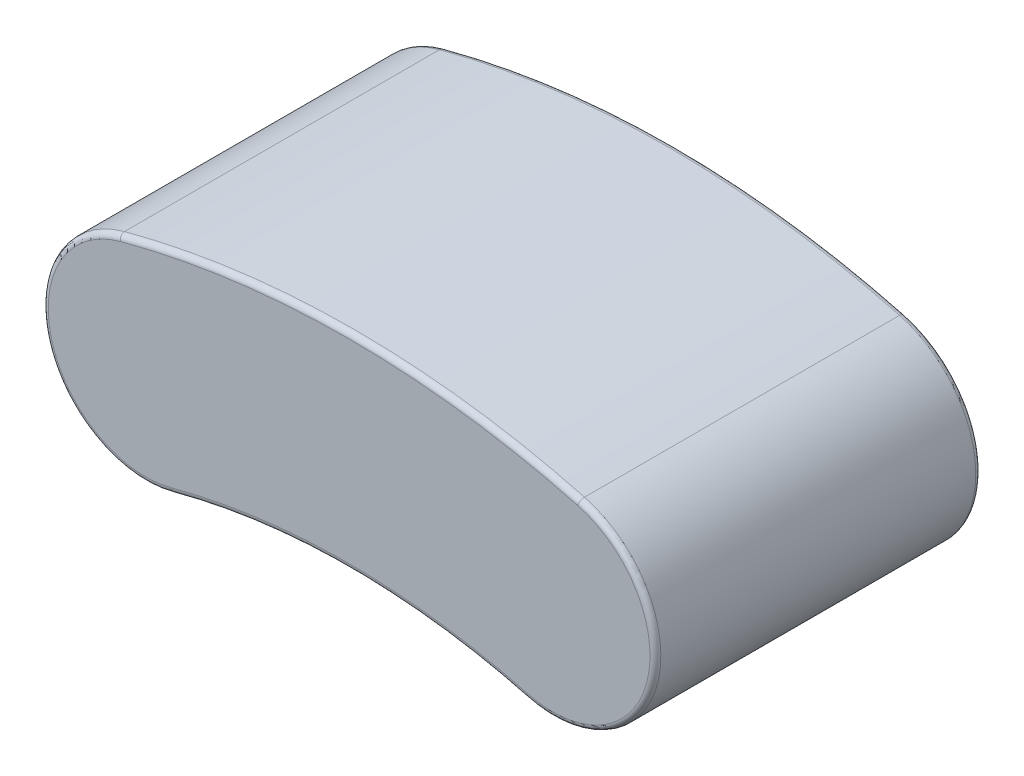
from build123d import *

# Parameters (mm, degrees)
BOSS_EXTRU_1_DEPTH = 120
CONG_1_R           = 2
CONG_2_R           = 2
COQUE1_DEPTH       = 117


# Read off the part's stored shape, not the designer's step: Coque1
with BuildPart() as part:
    # Esquisse2 → Boss.-Extru.1 (new body)
    with BuildSketch(Plane.XY):
        with BuildLine():
            ThreePointArc((84.733796148, 26.7419608), (0, 37.829829119), (-84.733796148, 26.7419608))
            ThreePointArc((-84.733796148, 26.7419608), (-111.556110074, -19.547945422), (-65.266203852, -46.370259347))
            ThreePointArc((-65.266203852, -46.370259347), (0, -37.829829119), (65.266203852, -46.370259347))
            ThreePointArc((65.266203852, -46.370259347), (111.556110074, -19.547945422), (84.733796148, 26.7419608))
        make_face()
    extrude(amount=BOSS_EXTRU_1_DEPTH)

    # Congé1
    cong_1_edges = [part.edges().sort_by_distance(p)[0] for p in [
        (-111.556110074, -19.547945422, 120),
        (0, -37.829829119, 120),
        (111.556110074, -19.547945422, 120),
        (0, 37.829829119, 120),
    ]]
    fillet(cong_1_edges, radius=CONG_1_R)

    # Congé2
    cong_2_edges = [part.edges().sort_by_distance(p)[0] for p in [
        (0, -37.829829119, 0),
        (-111.556110074, -19.547945422, 0),
        (0, 37.829829119, 0),
        (111.556110074, -19.547945422, 0),
    ]]
    fillet(cong_2_edges, radius=CONG_2_R)

    # Coque1 outline → Coque1 (cut)
    with BuildSketch(Plane.XY):
        with BuildLine():
            ThreePointArc((66.038118215, -43.471268451), (108.657119178, -18.776031059), (83.961881785, 23.842969904))
            ThreePointArc((83.961881785, 23.842969904), (0, 34.829829119), (-83.961881785, 23.842969904))
            ThreePointArc((-83.961881785, 23.842969904), (-108.657119178, -18.776031059), (-66.038118215, -43.471268451))
            ThreePointArc((-66.038118215, -43.471268451), (0, -34.829829119), (66.038118215, -43.471268451))
        make_face()
    extrude(amount=COQUE1_DEPTH, mode=Mode.SUBTRACT)


solid = part.part
